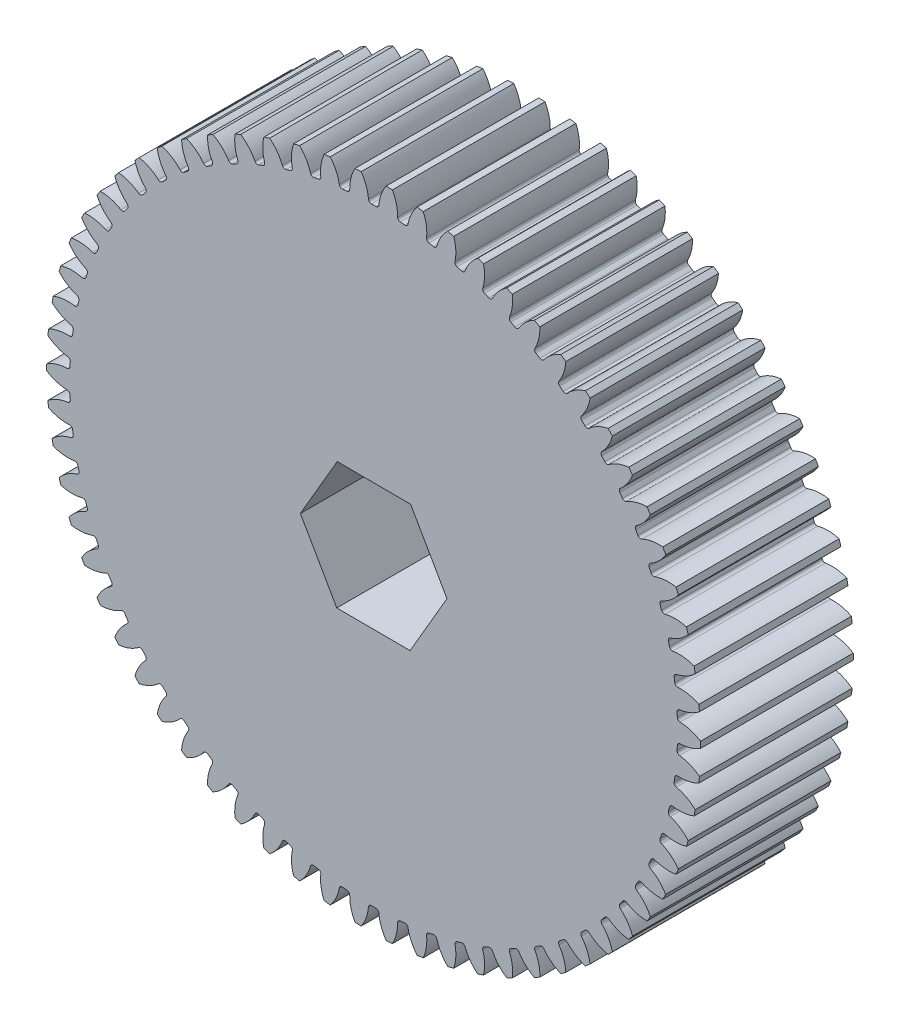
from build123d import *

# Parameters (mm, degrees)
BOSS_EXTRUDE1_DEPTH      = 12.7
BOSS_EXTRUDE1_DEPTH_BACK = 3.175
SKETCH1_R                = 34
CUT_EXTRUDE2_DEPTH       = 20
FILLET2_R                = 0.3
CIRPATTERN2_COUNT        = 66
FILLET2_OF_CIRPATTERN2_R = 0.3
CUT_EXTRUDE3_DEPTH       = 10


with BuildPart() as part:
    # Sketch1 → Boss-Extrude1 (new, two sides: drawn at the far end of the back side and taken through both)
    with BuildSketch(Plane.XY.offset(-BOSS_EXTRUDE1_DEPTH_BACK)):
        Circle(SKETCH1_R)
    extrude(amount=BOSS_EXTRUDE1_DEPTH + BOSS_EXTRUDE1_DEPTH_BACK)

    # Sketch3 → Cut-Extrude2 (cut)
    with BuildSketch(Plane(origin=(0, 0, -3.175), x_dir=(-1, 0, 0), z_dir=(0, 0, -1))):
        with BuildLine():
            ThreePointArc((-2.209815736, 34.930169115), (-0.986437749, 33.455692466), (-0.527318061, 31.595599941))
            ThreePointArc((-0.527318061, 31.595599941), (0, 31.6), (0.527318061, 31.595599941))
            ThreePointArc((0.527318061, 31.595599941), (0.986437749, 33.455692466), (2.209815736, 34.930169115))
            ThreePointArc((2.209815736, 34.930169115), (0, 35), (-2.209815736, 34.930169115))
        make_face()
    cut_extrude2 = extrude(amount=-CUT_EXTRUDE2_DEPTH, mode=Mode.SUBTRACT)

    # Fillet2
    fillet2_edges = [part.edges().sort_by_distance(p)[0] for p in [
        (-0.527318061, 31.595599941, 4.7625),
        (0.527318061, 31.595599941, 4.7625),
    ]]
    fillet(fillet2_edges, radius=FILLET2_R)

    # CirPattern2: Cut-Extrude2 ×66 about axis
    cirpattern2_axis = Axis((0, 0, -3.175), (0, 0, 1))
    for i in range(1, CIRPATTERN2_COUNT):
        add(cut_extrude2.rotate(cirpattern2_axis, i * 360 / CIRPATTERN2_COUNT), mode=Mode.SUBTRACT)

    # Fillet2 of CirPattern2
    fillet2_of_cirpattern2_edges = [part.edges().sort_by_distance(p)[0] for p in [
        (-3.52828304, 31.40240785, 4.7625),
        (-2.478422392, 31.502657387, 4.7625),
        (-6.497295342, 30.924830691, 4.7625),
        (-5.461717869, 31.124421889, 4.7625),
        (-9.407467131, 30.167193475, 4.7625),
        (-8.395551182, 30.464318807, 4.7625),
        (-12.23244344, 29.136357485, 4.7625),
        (-11.253353084, 29.528326135, 4.7625),
        (-14.946640848, 27.841658129, 4.7625),
        (-14.009242878, 28.32492037, 4.7625),
        (-17.525479162, 26.294820405, 4.7625),
        (-16.638262799, 26.86499974, 4.7625),
        (-19.945604022, 24.509852716, 4.7625),
        (-19.116604035, 25.161785512, 4.7625),
        (-22.185098404, 22.502920006, 4.7625),
        (-21.421822345, 23.230702258, 4.7625),
        (-24.2236811, 20.292197367, 4.7625),
        (-23.533041315, 21.089238167, 4.7625),
        (-26.042890388, 17.897705447, 4.7625),
        (-25.431141418, 18.75678667, 4.7625),
        (-27.626251228, 15.341129134, 4.7625),
        (-27.098933167, 16.254470807, 4.7625),
        (-28.959424458, 12.645621181, 4.7625),
        (-28.52131278, 13.60495194, 4.7625),
        (-30.030336657, 9.835592523, 4.7625),
        (-29.685398968, 10.832224522, 4.7625),
        (-30.829289476, 6.936491217, 4.7625),
        (-30.580649587, 7.961398801, 4.7625),
        (-31.349047476, 3.974571973, 4.7625),
        (-31.198957107, 5.018473419, 4.7625),
        (-31.584903647, 0.976658389, 4.7625),
        (-31.53472204, 2.030099965, 4.7625),
        (-31.53472204, -2.030099965, 4.7625),
        (-31.584903647, -0.976658389, 4.7625),
        (-31.198957107, -5.018473419, 4.7625),
        (-31.349047476, -3.974571973, 4.7625),
        (-30.580649587, -7.961398801, 4.7625),
        (-30.829289476, -6.936491217, 4.7625),
        (-29.685398968, -10.832224522, 4.7625),
        (-30.030336657, -9.835592523, 4.7625),
        (-28.52131278, -13.60495194, 4.7625),
        (-28.959424458, -12.645621181, 4.7625),
        (-27.098933167, -16.254470807, 4.7625),
        (-27.626251228, -15.341129134, 4.7625),
        (-25.431141418, -18.75678667, 4.7625),
        (-26.042890388, -17.897705447, 4.7625),
        (-23.533041315, -21.089238167, 4.7625),
        (-24.2236811, -20.292197367, 4.7625),
        (-21.421822345, -23.230702258, 4.7625),
        (-22.185098404, -22.502920006, 4.7625),
        (-19.116604035, -25.161785512, 4.7625),
        (-19.945604022, -24.509852716, 4.7625),
        (-16.638262799, -26.86499974, 4.7625),
        (-17.525479162, -26.294820405, 4.7625),
        (-14.009242878, -28.32492037, 4.7625),
        (-14.946640848, -27.841658129, 4.7625),
        (-11.253353084, -29.528326135, 4.7625),
        (-12.23244344, -29.136357485, 4.7625),
        (-8.395551182, -30.464318807, 4.7625),
        (-9.407467131, -30.167193475, 4.7625),
        (-5.461717869, -31.124421889, 4.7625),
        (-6.497295342, -30.924830691, 4.7625),
        (-2.478422392, -31.502657387, 4.7625),
        (-3.52828304, -31.40240785, 4.7625),
        (0.527318061, -31.595599941, 4.7625),
        (-0.527318061, -31.595599941, 4.7625),
        (3.52828304, -31.40240785, 4.7625),
        (2.478422392, -31.502657387, 4.7625),
        (6.497295342, -30.924830691, 4.7625),
        (5.461717869, -31.124421889, 4.7625),
        (9.407467131, -30.167193475, 4.7625),
        (8.395551182, -30.464318807, 4.7625),
        (12.23244344, -29.136357485, 4.7625),
        (11.253353084, -29.528326135, 4.7625),
        (14.946640848, -27.841658129, 4.7625),
        (14.009242878, -28.32492037, 4.7625),
        (17.525479162, -26.294820405, 4.7625),
        (16.638262799, -26.86499974, 4.7625),
        (19.945604022, -24.509852716, 4.7625),
        (19.116604035, -25.161785512, 4.7625),
        (22.185098404, -22.502920006, 4.7625),
        (21.421822345, -23.230702258, 4.7625),
        (24.2236811, -20.292197367, 4.7625),
        (23.533041315, -21.089238167, 4.7625),
        (26.042890388, -17.897705447, 4.7625),
        (25.431141418, -18.75678667, 4.7625),
        (27.626251228, -15.341129134, 4.7625),
        (27.098933167, -16.254470807, 4.7625),
        (28.959424458, -12.645621181, 4.7625),
        (28.52131278, -13.60495194, 4.7625),
        (30.030336657, -9.835592523, 4.7625),
        (29.685398968, -10.832224522, 4.7625),
        (30.829289476, -6.936491217, 4.7625),
        (30.580649587, -7.961398801, 4.7625),
        (31.349047476, -3.974571973, 4.7625),
        (31.198957107, -5.018473419, 4.7625),
        (31.584903647, -0.976658389, 4.7625),
        (31.53472204, -2.030099965, 4.7625),
        (31.53472204, 2.030099965, 4.7625),
        (31.584903647, 0.976658389, 4.7625),
        (31.198957107, 5.018473419, 4.7625),
        (31.349047476, 3.974571973, 4.7625),
        (30.580649587, 7.961398801, 4.7625),
        (30.829289476, 6.936491217, 4.7625),
        (29.685398968, 10.832224522, 4.7625),
        (30.030336657, 9.835592523, 4.7625),
        (28.52131278, 13.60495194, 4.7625),
        (28.959424458, 12.645621181, 4.7625),
        (27.098933167, 16.254470807, 4.7625),
        (27.626251228, 15.341129134, 4.7625),
        (25.431141418, 18.75678667, 4.7625),
        (26.042890388, 17.897705447, 4.7625),
        (23.533041315, 21.089238167, 4.7625),
        (24.2236811, 20.292197367, 4.7625),
        (21.421822345, 23.230702258, 4.7625),
        (22.185098404, 22.502920006, 4.7625),
        (19.116604035, 25.161785512, 4.7625),
        (19.945604022, 24.509852716, 4.7625),
        (16.638262799, 26.86499974, 4.7625),
        (17.525479162, 26.294820405, 4.7625),
        (14.009242878, 28.32492037, 4.7625),
        (14.946640848, 27.841658129, 4.7625),
        (11.253353084, 29.528326135, 4.7625),
        (12.23244344, 29.136357485, 4.7625),
        (8.395551182, 30.464318807, 4.7625),
        (9.407467131, 30.167193475, 4.7625),
        (5.461717869, 31.124421889, 4.7625),
        (6.497295342, 30.924830691, 4.7625),
        (2.478422392, 31.502657387, 4.7625),
        (3.52828304, 31.40240785, 4.7625),
    ]]
    fillet(fillet2_of_cirpattern2_edges, radius=FILLET2_OF_CIRPATTERN2_R)

    # Sketch4 → Cut-Extrude3 (cut)
    with BuildSketch(Plane.XY.offset(12.7)):
        Polygon((3.836203431, 6.590444945), (-3.789391029, 6.617472098), (-7.62559446, 0.027027153), (-3.836203431, -6.590444945), (3.789391029, -6.617472098), (7.62559446, -0.027027153), align=None)
    extrude(amount=-CUT_EXTRUDE3_DEPTH, mode=Mode.SUBTRACT)


solid = part.part
